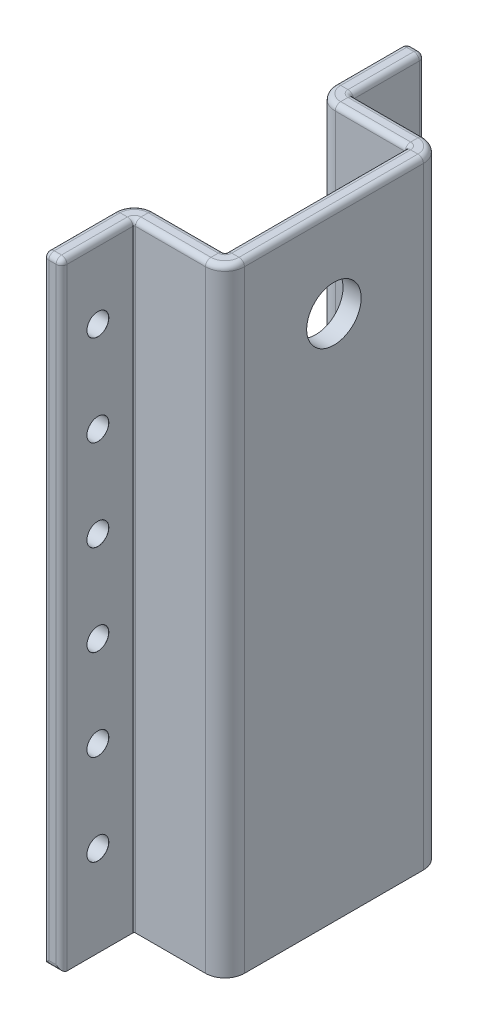
from build123d import *

# Parameters (mm, degrees)
SKETCH1_W                       = 120
SKETCH1_H                       = 340
BASE_FLANGE1_DEPTH              = 10
EDGE_FLANGE1_STRIP_W            = 41.4732
EDGE_FLANGE1_STRIP_H            = 10
EDGE_FLANGE1_STRIP_CUT_DEPTH    = 340
EDGE_FLANGE1_STRIP_2_W          = 41.4732
EDGE_FLANGE1_STRIP_2_H          = 10
EDGE_FLANGE1_STRIP_CUT_2_DEPTH  = 340
EDGE_FLANGE1_DEPTH              = 340
EDGE_FLANGE1_BEND_DEPTH         = 340
EDGE_FLANGE2_STRIP_W            = 41.4732
EDGE_FLANGE2_STRIP_H            = 10
EDGE_FLANGE2_STRIP_CUT_DEPTH    = 340
EDGE_FLANGE2_STRIP_2_W          = 41.4732
EDGE_FLANGE2_STRIP_2_H          = 10
EDGE_FLANGE2_STRIP_CUT_2_DEPTH  = 340
EDGE_FLANGE2_DEPTH              = 340
EDGE_FLANGE2_BEND_DEPTH         = 340
SKETCH18_R                      = 15
CUT_EXTRUDE1_DEPTH              = 207.155281281
M10_CLEARANCE_HOLE1_D           = 12
M10_CLEARANCE_HOLE1_CSINK_D     = 12.05
M10_CLEARANCE_HOLE1_CSINK_ANGLE = 90
FILLET1_R                       = 3


# Sheet-metal steps are written as plain solids
with BuildPart() as part:
    # Sketch1 → Base-Flange1 (new body)
    with BuildSketch(Plane(origin=(0, 0, 0), x_dir=(0, 0, -1), z_dir=(1, 0, 0))):
        Rectangle(SKETCH1_W, SKETCH1_H)
    extrude(amount=BASE_FLANGE1_DEPTH)

    # Edge-Flange1 strip (across the edge) → Edge-Flange1 strip cut (cut)
    with BuildSketch(Plane(origin=(0, -170, 60), x_dir=(0, 0, -1), z_dir=(0, 1, 0))):
        with Locations((-10, -5)):
            Rectangle(EDGE_FLANGE1_STRIP_W, EDGE_FLANGE1_STRIP_H)
    extrude(amount=EDGE_FLANGE1_STRIP_CUT_DEPTH, mode=Mode.SUBTRACT)

    # Edge-Flange1 strip 2 (across the edge) → Edge-Flange1 strip cut 2 (cut)
    with BuildSketch(Plane(origin=(0, 170, -60), x_dir=(0, 0, 1), z_dir=(0, -1, 0))):
        with Locations((-10, -5)):
            Rectangle(EDGE_FLANGE1_STRIP_2_W, EDGE_FLANGE1_STRIP_2_H)
    extrude(amount=EDGE_FLANGE1_STRIP_CUT_2_DEPTH, mode=Mode.SUBTRACT)

    # Edge-Flange1 section (across the edge) → Edge-Flange1 (add)
    with BuildSketch(Plane(origin=(0, -170, 60), x_dir=(0, 0, -1), z_dir=(0, 1, 0))):
        with BuildLine():
            Line((0, 0.7366), (0, 50))
            Line((0, 50), (10, 50))
            Line((10, 50), (10, 0.7366))
            ThreePointArc((10, 0.7366), (10.215745145, 0.215745145), (10.7366, 0))
            Line((10.7366, 0), (10.7366, -10))
            ThreePointArc((10.7366, -10), (3.144677333, -6.855322667), (0, 0.7366))
        make_face()
    extrude(amount=EDGE_FLANGE1_DEPTH)

    # Edge-Flange1 section 2 (across the edge) → Edge-Flange1 bend (add)
    with BuildSketch(Plane(origin=(0, 170, -60), x_dir=(0, 0, 1), z_dir=(0, -1, 0))):
        with BuildLine():
            Line((0, 0.7366), (0, 50))
            Line((0, 50), (10, 50))
            Line((10, 50), (10, 0.7366))
            ThreePointArc((10, 0.7366), (10.215745145, 0.215745145), (10.7366, 0))
            Line((10.7366, 0), (10.7366, -10))
            ThreePointArc((10.7366, -10), (3.144677333, -6.855322667), (0, 0.7366))
        make_face()
    extrude(amount=EDGE_FLANGE1_BEND_DEPTH)

    # Edge-Flange2 strip (across the edge) → Edge-Flange2 strip cut (cut)
    with BuildSketch(Plane(origin=(-50, 170, 60), x_dir=(1, 0, 0), z_dir=(0, -1, 0))):
        with Locations((-10, -5)):
            Rectangle(EDGE_FLANGE2_STRIP_W, EDGE_FLANGE2_STRIP_H)
    extrude(amount=EDGE_FLANGE2_STRIP_CUT_DEPTH, mode=Mode.SUBTRACT)

    # Edge-Flange2 strip 2 (across the edge) → Edge-Flange2 strip cut 2 (cut)
    with BuildSketch(Plane(origin=(-50, -170, -60), x_dir=(1, 0, 0), z_dir=(0, 1, 0))):
        with Locations((-10, -5)):
            Rectangle(EDGE_FLANGE2_STRIP_2_W, EDGE_FLANGE2_STRIP_2_H)
    extrude(amount=EDGE_FLANGE2_STRIP_CUT_2_DEPTH, mode=Mode.SUBTRACT)

    # Edge-Flange2 section (across the edge) → Edge-Flange2 (add)
    with BuildSketch(Plane(origin=(-50, 170, 60), x_dir=(1, 0, 0), z_dir=(0, -1, 0))):
        with BuildLine():
            Line((0, 0.7366), (0, 40))
            Line((0, 40), (10, 40))
            Line((10, 40), (10, 0.7366))
            ThreePointArc((10, 0.7366), (10.215745145, 0.215745145), (10.7366, 0))
            Line((10.7366, 0), (10.7366, -10))
            ThreePointArc((10.7366, -10), (3.144677333, -6.855322667), (0, 0.7366))
        make_face()
    extrude(amount=EDGE_FLANGE2_DEPTH)

    # Edge-Flange2 section 2 (across the edge) → Edge-Flange2 bend (add)
    with BuildSketch(Plane(origin=(-50, -170, -60), x_dir=(1, 0, 0), z_dir=(0, 1, 0))):
        with BuildLine():
            Line((0, 0.7366), (0, 40))
            Line((0, 40), (10, 40))
            Line((10, 40), (10, 0.7366))
            ThreePointArc((10, 0.7366), (10.215745145, 0.215745145), (10.7366, 0))
            Line((10.7366, 0), (10.7366, -10))
            ThreePointArc((10.7366, -10), (3.144677333, -6.855322667), (0, 0.7366))
        make_face()
    extrude(amount=EDGE_FLANGE2_BEND_DEPTH)

    # Sketch18 → Cut-Extrude1 (cut, through all)
    with BuildSketch(Plane(origin=(10, 0, 0), x_dir=(0, 0, -1), z_dir=(1, 0, 0))):
        with Locations((0, 120)):
            Circle(SKETCH18_R)
    extrude(amount=-CUT_EXTRUDE1_DEPTH, mode=Mode.SUBTRACT)

    # M10 Clearance Hole1 (through all)
    with Locations(Plane(origin=(-40, 0, 0), x_dir=(0, 0, -1), z_dir=(1, 0, 0))):
        with Locations((80, -120), (80, -70), (80, -20), (80, 30), (80, 80), (80, 130)):
            m10_clearance_hole1 = CounterSinkHole(M10_CLEARANCE_HOLE1_D / 2, M10_CLEARANCE_HOLE1_CSINK_D / 2, counter_sink_angle=M10_CLEARANCE_HOLE1_CSINK_ANGLE)

    # Mirror1: M10 Clearance Hole1 across plane
    add(m10_clearance_hole1.mirror(Plane.XY), mode=Mode.SUBTRACT)

    # Fillet1
    fillet1_edges = [part.edges().sort_by_distance(p)[0] for p in [
        (-46.855322667, 170, 53.144677333),
        (-39.784254855, 170, 60.215745145),
        (-45, 170, 100),
        (-40, 170, 80.3683),
        (-50, 0, 100),
        (-50, 170, 80.3683),
        (-40, 0, 100),
        (-45, -170, 100),
        (-46.855322667, 170, -53.144677333),
        (-39.784254855, 170, -60.215745145),
        (-45, -170, -100),
        (-40, 170, -80.3683),
        (-50, 170, -80.3683),
        (-50, 0, -100),
        (-40, 0, -100),
        (-45, 170, -100),
        (0, 170, 0),
        (10, 170, 0),
        (6.855322667, 170, 56.855322667),
        (-0.215745145, 170, 49.784254855),
        (-20, 170, 50),
        (-20, 170, 60),
        (6.855322667, 170, -56.855322667),
        (-0.215745145, 170, -49.784254855),
        (-20, 170, -50),
        (-20, 170, -60),
    ]]
    fillet(fillet1_edges, radius=FILLET1_R)


solid = part.part
